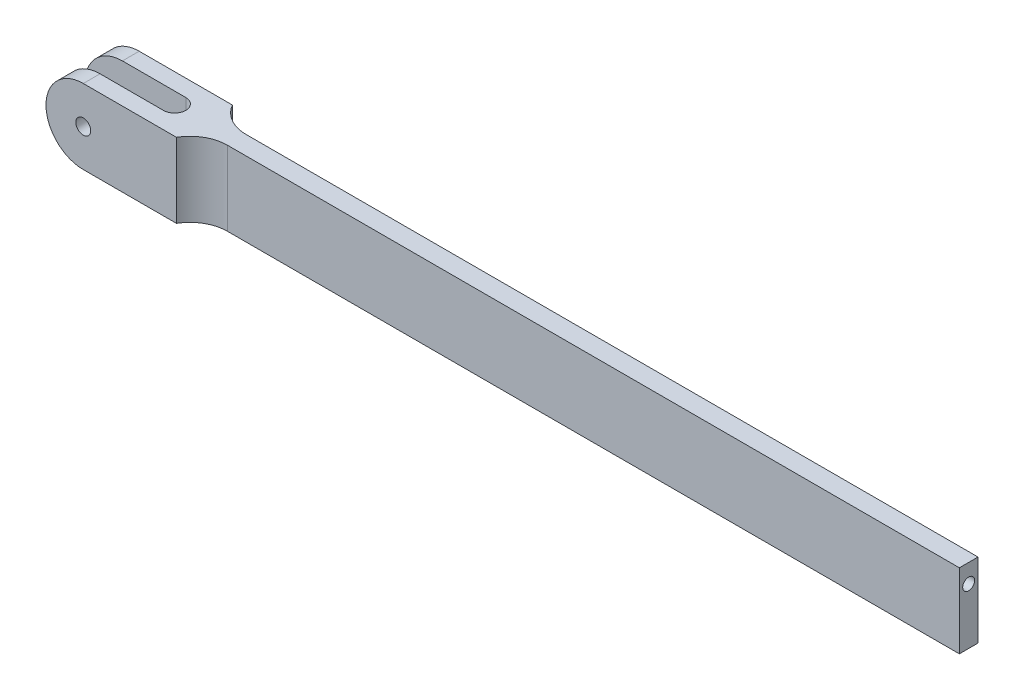
from build123d import *

# Parameters (mm, degrees)
SKETCH1_R                = 2
BOSS_EXTRUDE1_DEPTH      = 5
BOSS_EXTRUDE2_DEPTH      = 5
BOSS_EXTRUDE2_DEPTH_BACK = 10
SKETCH2_R                = 2
SKETCH4_W                = 40
SKETCH4_H                = 6
CUT_EXTRUDE1_DEPTH       = 232.084400166
FILLET1_R                = 10
FILLET2_R                = 3
SKETCH5_R                = 1.6
CUT_EXTRUDE2_DEPTH       = 20


# Some blends are built 0.0001 mm under size
with BuildPart() as part:
    # Sketch1 → Boss-Extrude1 (new body)
    with BuildSketch(Plane.XY):
        with BuildLine():
            Line((0, 10), (230, 10))
            Line((230, 10), (230, -10))
            Line((230, -10), (0, -10))
            ThreePointArc((0, -10), (-10, 0), (0, 10))
        make_face()
        Circle(SKETCH1_R, mode=Mode.SUBTRACT)
    extrude(amount=BOSS_EXTRUDE1_DEPTH)

    # Sketch2 → Boss-Extrude2 (add, two sides: drawn at the far end of the back side and taken through both)
    with BuildSketch(Plane.XY.offset(5).offset(-BOSS_EXTRUDE2_DEPTH_BACK)):
        with BuildLine():
            Line((25, -10), (25, 10))
            Line((25, 10), (0, 10))
            ThreePointArc((0, 10), (-10, 0), (0, -10))
            Line((0, -10), (25, -10))
        make_face()
        Circle(SKETCH2_R, mode=Mode.SUBTRACT)
    extrude(amount=BOSS_EXTRUDE2_DEPTH + BOSS_EXTRUDE2_DEPTH_BACK)

    # Sketch4 → Cut-Extrude1 (cut, through all)
    with BuildSketch(Plane(origin=(0, 10, 0), x_dir=(1, 0, 0), z_dir=(0, 1, 0))):
        with Locations((0, -2.5)):
            Rectangle(SKETCH4_W, SKETCH4_H)
    extrude(amount=-CUT_EXTRUDE1_DEPTH, mode=Mode.SUBTRACT)

    # Fillet1
    # the kernel refuses this fillet: 10 mm, written as the material it adds along each edge
    with BuildSketch(Plane(origin=(25, -10, 5), x_dir=(1, 0, 0), z_dir=(0, 1, 0))) as fillet1_piece_1:
        with BuildLine():
            CenterArc((8.660254038, -10), FILLET1_R, 90, 60)
            Line((0, -5), (-0.173205081, -4.9))
            ThreePointArc((-0.173205081, -4.9), (-0.2, -2.5), (-0.2, 0))
            Line((-0.2, 0), (0, 0.2))
            Line((0, 0.2), (8.660254038, 0.2))
            Line((8.660254038, 0.2), (8.660254038, 0))
        make_face()
    extrude(amount=20)
    with BuildSketch(Plane(origin=(25, -10, 0), x_dir=(0, 0, -1), z_dir=(0, 1, 0))) as fillet1_piece_2:
        with BuildLine():
            CenterArc((10, -8.660254038), FILLET1_R, 120, 60)
            Line((0, -8.660254038), (-0.2, -8.660254038))
            Line((-0.2, -8.660254038), (-0.2, 0))
            Line((-0.2, 0), (0, 0.2))
            ThreePointArc((0, 0.2), (2.5, 0.2), (4.9, 0.173205081))
            Line((4.9, 0.173205081), (5, 0))
        make_face()
    extrude(amount=20)

    # Fillet2
    fillet2_edges = [part.edges().sort_by_distance(p)[0] for p in [
        (20, 0, -0.5),
        (20, 0, 5.5),
    ]]
    fillet(fillet2_edges, radius=FILLET2_R - 0.0001)  # a hair under: the kernel refuses the full size

    # Sketch5 → Cut-Extrude2 (cut)
    with BuildSketch(Plane(origin=(230, 0, 0), x_dir=(0, 0, -1), z_dir=(1, 0, 0))):
        with Locations((-2.5, 5)):
            Circle(SKETCH5_R)
    extrude(amount=-CUT_EXTRUDE2_DEPTH, mode=Mode.SUBTRACT)


solid = part.part
